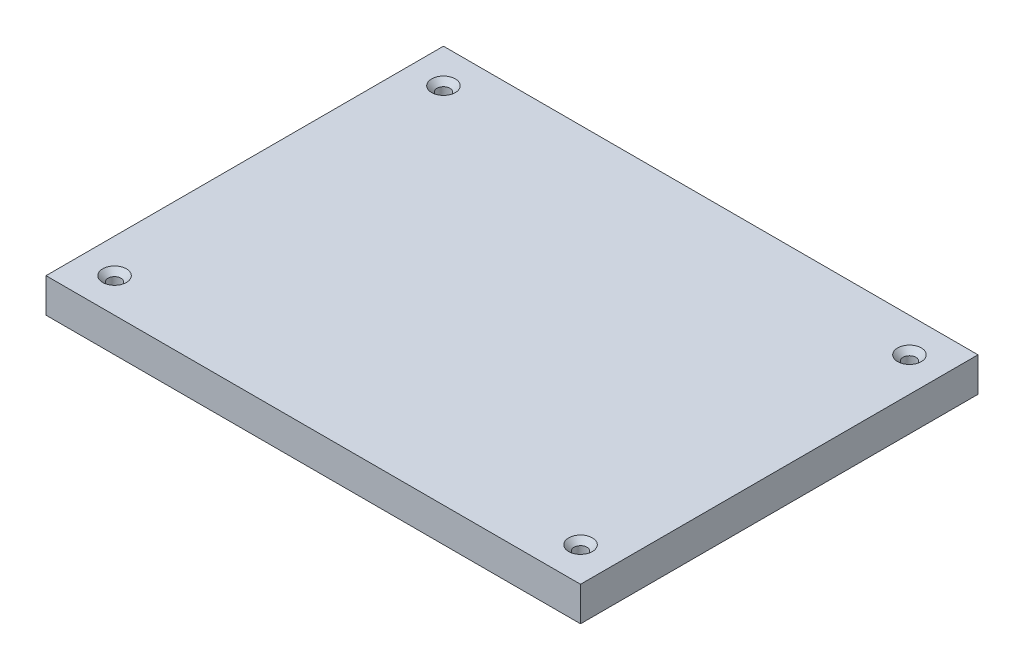
from build123d import *

# Parameters (mm, degrees)
SKETCH1_W                                       = 99.06
SKETCH1_H                                       = 73.66
BOSS_EXTRUDE1_DEPTH                             = 6.35
CSK_FOR_M2_FLAT_HEAD_MACHINE_SCREW1_D           = 2.4
CSK_FOR_M2_FLAT_HEAD_MACHINE_SCREW1_CSINK_D     = 4.4
CSK_FOR_M2_FLAT_HEAD_MACHINE_SCREW1_CSINK_ANGLE = 90
SHELL1_DEPTH                                    = 1.5875


# Read off the part's stored shape, not the designer's step: Shell1
with BuildPart() as part:
    # Sketch1 → Boss-Extrude1 (new body)
    with BuildSketch(Plane(origin=(0, 0, 0), x_dir=(1, 0, 0), z_dir=(0, 1, 0))):
        Rectangle(SKETCH1_W, SKETCH1_H)
    extrude(amount=BOSS_EXTRUDE1_DEPTH)

    # CSK for M2 Flat Head Machine Screw1 (through all)
    with Locations(Plane(origin=(0, 6.35, 0), x_dir=(1, 0, 0), z_dir=(0, 1, 0))):
        with Locations((-43.18, 30.48), (-43.18, -30.48), (43.18, -30.48), (43.18, 30.48)):
            CounterSinkHole(CSK_FOR_M2_FLAT_HEAD_MACHINE_SCREW1_D / 2, CSK_FOR_M2_FLAT_HEAD_MACHINE_SCREW1_CSINK_D / 2, counter_sink_angle=CSK_FOR_M2_FLAT_HEAD_MACHINE_SCREW1_CSINK_ANGLE)

    # Shell1 outline → Shell1 (cut)
    with BuildSketch(Plane(origin=(0, 0, 0), x_dir=(1, 0, 0), z_dir=(0, 1, 0))):
        with BuildLine():
            Line((44.7675, -24.732718034), (44.7675, 24.732718034))
            ThreePointArc((44.7675, 24.732718034), (38.963875817, 26.263875817), (37.432718034, 32.0675))
            Line((37.432718034, 32.0675), (-37.432718034, 32.0675))
            ThreePointArc((-37.432718034, 32.0675), (-38.963875817, 26.263875817), (-44.7675, 24.732718034))
            Line((-44.7675, 24.732718034), (-44.7675, -24.732718034))
            ThreePointArc((-44.7675, -24.732718034), (-38.963875817, -26.263875817), (-37.432718034, -32.0675))
            Line((-37.432718034, -32.0675), (37.432718034, -32.0675))
            ThreePointArc((37.432718034, -32.0675), (38.963875817, -26.263875817), (44.7675, -24.732718034))
        make_face()
    extrude(amount=SHELL1_DEPTH, mode=Mode.SUBTRACT)


solid = part.part
